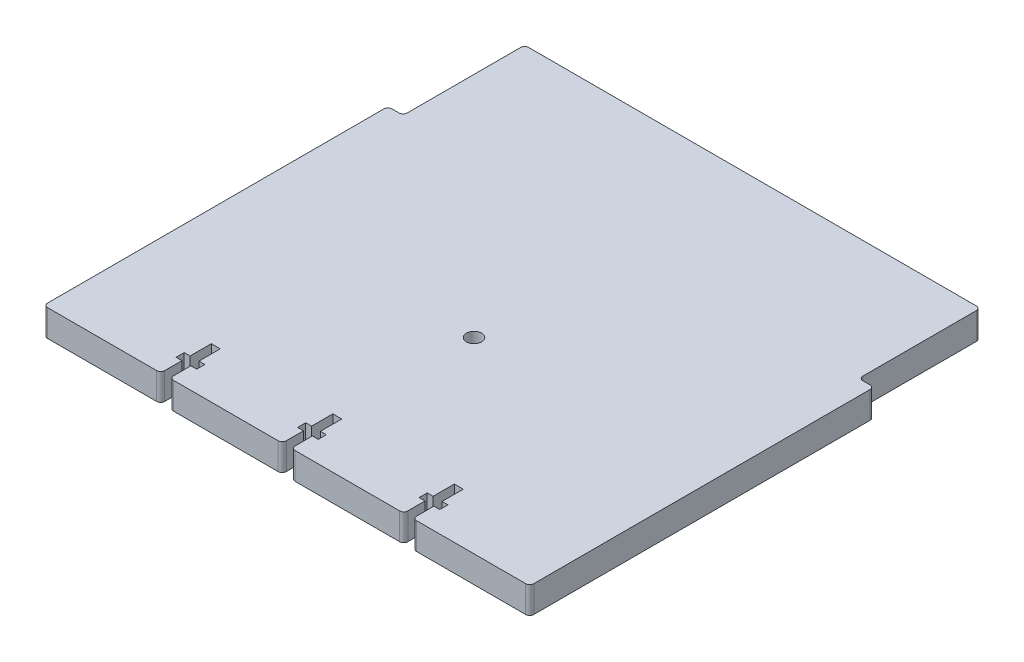
from build123d import *

# Parameters (mm, degrees)
BOSS_EXTRUDE1_DEPTH            = 8.382
CUT_EXTRUDE2_DEPTH             = 208.840544241
F_3_16_0_1875_DIAMETER_HOLE1_D = 4.7625
FILLET1_R                      = 1.27


with BuildPart() as part:
    # Sketch1 → Boss-Extrude1 (new body)
    with BuildSketch(Plane(origin=(0, 0, 0), x_dir=(1, 0, 0), z_dir=(0, 1, 0))):
        Polygon((0, 0), (142.875, 0), (147.6375, 0), (147.6375, 107.95), (142.875, 107.95), (142.875, 146.05), (0, 146.05), (0, 107.95), (-4.7625, 107.95), (-4.7625, 0), align=None)
    extrude(amount=BOSS_EXTRUDE1_DEPTH)

    # Sketch10 → Cut-Extrude2 (cut, through all)
    with BuildSketch(Plane(origin=(0, 8.382, 0), x_dir=(1, 0, 0), z_dir=(0, 1, 0))):
        Polygon((70.0405, 9.2075), (68.199, 9.2075), (68.199, 6.6675), (70.0405, 6.6675), (70.0405, 0), (72.8345, 0), (72.8345, 6.6675), (74.676, 6.6675), (74.676, 9.2075), (72.8345, 9.2075), (72.8345, 15.875), (70.0405, 15.875), align=None)
        Polygon((108.1405, 15.875), (110.9345, 15.875), (110.9345, 9.2075), (112.776, 9.2075), (112.776, 6.6675), (110.9345, 6.6675), (110.9345, 0), (108.1405, 0), (108.1405, 6.6675), (106.299, 6.6675), (106.299, 9.2075), (108.1405, 9.2075), align=None)
        Polygon((34.7345, 15.875), (34.7345, 9.2075), (36.576, 9.2075), (36.576, 6.6675), (34.7345, 6.6675), (34.7345, 0), (31.9405, 0), (31.9405, 6.6675), (30.099, 6.6675), (30.099, 9.2075), (31.9405, 9.2075), (31.9405, 15.875), align=None)
    extrude(amount=-CUT_EXTRUDE2_DEPTH, mode=Mode.SUBTRACT)

    # 3/16 (0.1875) Diameter Hole1 (through all)
    with Locations(Plane(origin=(0, 0, 0), x_dir=(-1, 0, 0), z_dir=(0, -1, 0))):
        with Locations((-71.4375, 58.7375)):
            Hole(F_3_16_0_1875_DIAMETER_HOLE1_D / 2)

    # Fillet1
    fillet1_edges = [part.edges().sort_by_distance(p)[0] for p in [
        (72.8345, 4.191, 0),
        (70.0405, 4.191, 0),
        (147.6375, 4.191, -107.95),
        (142.875, 4.191, -107.95),
        (142.875, 4.191, -146.05),
        (0, 4.191, -107.95),
        (0, 4.191, -146.05),
        (-4.7625, 4.191, -107.95),
        (-4.7625, 4.191, 0),
        (147.6375, 4.191, 0),
        (108.1405, 4.191, 0),
        (110.9345, 4.191, 0),
        (34.7345, 4.191, 0),
        (31.9405, 4.191, 0),
    ]]
    fillet(fillet1_edges, radius=FILLET1_R)


solid = part.part
